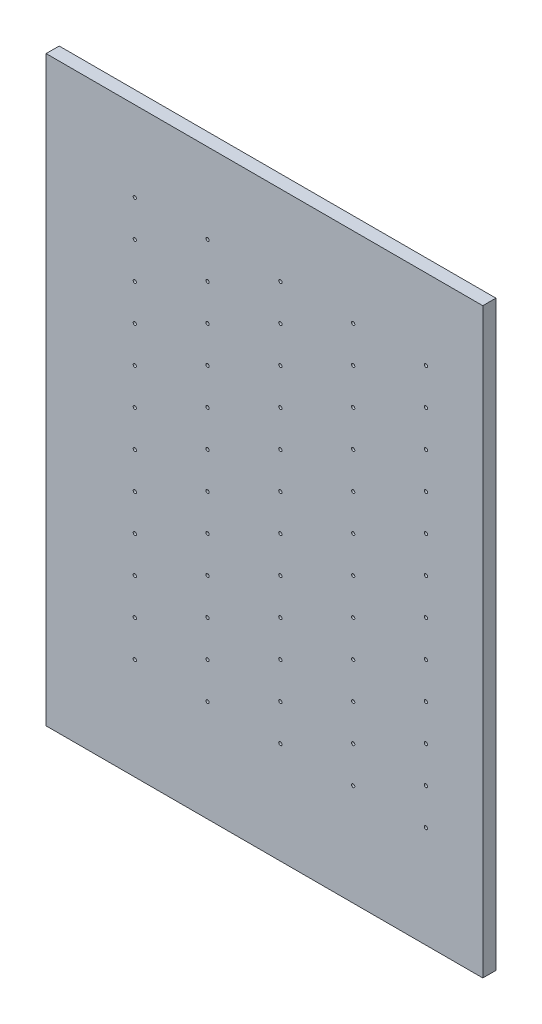
from build123d import *

# Parameters (mm, degrees)
SKETCH_1_W          = 600
SKETCH_1_H          = 800
EXTRUDE_1_DEPTH     = 18
SKETCH_2_R          = 2.25
CUT_EXTRUDE_1_DEPTH = 9


with BuildPart() as part:
    # Эскиз1 → Бобышка-Вытянуть1 (new body)
    with BuildSketch(Plane.XY):
        with Locations((300, 400)):
            Rectangle(SKETCH_1_W, SKETCH_1_H)
    extrude(amount=EXTRUDE_1_DEPTH)

    # Эскиз2 → Вырез-Вытянуть1 (cut)
    with BuildSketch(Plane.XY.offset(18)):
        with Locations((521.874452748, 139.781472365)):
            Circle(SKETCH_2_R)
        with Locations((421.874452748, 139.781472365)):
            Circle(SKETCH_2_R)
        with Locations((321.874452748, 139.781472365)):
            Circle(SKETCH_2_R)
        with Locations((221.874452748, 139.781472365)):
            Circle(SKETCH_2_R)
        with Locations((121.874452748, 139.781472365)):
            Circle(SKETCH_2_R)
        with Locations((421.874452748, 189.781472365)):
            Circle(SKETCH_2_R)
        with Locations((321.874452748, 189.781472365)):
            Circle(SKETCH_2_R)
        with Locations((221.874452748, 189.781472365)):
            Circle(SKETCH_2_R)
        with Locations((121.874452748, 189.781472365)):
            Circle(SKETCH_2_R)
        with Locations((421.874452748, 239.781472365)):
            Circle(SKETCH_2_R)
        with Locations((321.874452748, 239.781472365)):
            Circle(SKETCH_2_R)
        with Locations((221.874452748, 239.781472365)):
            Circle(SKETCH_2_R)
        with Locations((121.874452748, 239.781472365)):
            Circle(SKETCH_2_R)
        with Locations((421.874452748, 289.781472365)):
            Circle(SKETCH_2_R)
        with Locations((321.874452748, 289.781472365)):
            Circle(SKETCH_2_R)
        with Locations((221.874452748, 289.781472365)):
            Circle(SKETCH_2_R)
        with Locations((121.874452748, 289.781472365)):
            Circle(SKETCH_2_R)
        with Locations((421.874452748, 339.781472365)):
            Circle(SKETCH_2_R)
        with Locations((321.874452748, 339.781472365)):
            Circle(SKETCH_2_R)
        with Locations((221.874452748, 339.781472365)):
            Circle(SKETCH_2_R)
        with Locations((121.874452748, 339.781472365)):
            Circle(SKETCH_2_R)
        with Locations((421.874452748, 389.781472365)):
            Circle(SKETCH_2_R)
        with Locations((321.874452748, 389.781472365)):
            Circle(SKETCH_2_R)
        with Locations((221.874452748, 389.781472365)):
            Circle(SKETCH_2_R)
        with Locations((121.874452748, 389.781472365)):
            Circle(SKETCH_2_R)
        with Locations((421.874452748, 439.781472365)):
            Circle(SKETCH_2_R)
        with Locations((321.874452748, 439.781472365)):
            Circle(SKETCH_2_R)
        with Locations((221.874452748, 439.781472365)):
            Circle(SKETCH_2_R)
        with Locations((121.874452748, 439.781472365)):
            Circle(SKETCH_2_R)
        with Locations((421.874452748, 489.781472365)):
            Circle(SKETCH_2_R)
        with Locations((321.874452748, 489.781472365)):
            Circle(SKETCH_2_R)
        with Locations((221.874452748, 489.781472365)):
            Circle(SKETCH_2_R)
        with Locations((121.874452748, 489.781472365)):
            Circle(SKETCH_2_R)
        with Locations((421.874452748, 539.781472365)):
            Circle(SKETCH_2_R)
        with Locations((321.874452748, 539.781472365)):
            Circle(SKETCH_2_R)
        with Locations((221.874452748, 539.781472365)):
            Circle(SKETCH_2_R)
        with Locations((121.874452748, 539.781472365)):
            Circle(SKETCH_2_R)
        with Locations((421.874452748, 589.781472365)):
            Circle(SKETCH_2_R)
        with Locations((321.874452748, 589.781472365)):
            Circle(SKETCH_2_R)
        with Locations((221.874452748, 589.781472365)):
            Circle(SKETCH_2_R)
        with Locations((121.874452748, 589.781472365)):
            Circle(SKETCH_2_R)
        with Locations((421.874452748, 639.781472365)):
            Circle(SKETCH_2_R)
        with Locations((321.874452748, 639.781472365)):
            Circle(SKETCH_2_R)
        with Locations((221.874452748, 639.781472365)):
            Circle(SKETCH_2_R)
        with Locations((121.874452748, 639.781472365)):
            Circle(SKETCH_2_R)
        with Locations((421.874452748, 689.781472365)):
            Circle(SKETCH_2_R)
        with Locations((321.874452748, 689.781472365)):
            Circle(SKETCH_2_R)
        with Locations((221.874452748, 689.781472365)):
            Circle(SKETCH_2_R)
        with Locations((121.874452748, 689.781472365)):
            Circle(SKETCH_2_R)
        with Locations((521.874452748, 189.781472365)):
            Circle(SKETCH_2_R)
        with Locations((521.874452748, 239.781472365)):
            Circle(SKETCH_2_R)
        with Locations((521.874452748, 289.781472365)):
            Circle(SKETCH_2_R)
        with Locations((521.874452748, 339.781472365)):
            Circle(SKETCH_2_R)
        with Locations((521.874452748, 389.781472365)):
            Circle(SKETCH_2_R)
        with Locations((521.874452748, 439.781472365)):
            Circle(SKETCH_2_R)
        with Locations((521.874452748, 489.781472365)):
            Circle(SKETCH_2_R)
        with Locations((521.874452748, 539.781472365)):
            Circle(SKETCH_2_R)
        with Locations((521.874452748, 589.781472365)):
            Circle(SKETCH_2_R)
        with Locations((521.874452748, 639.781472365)):
            Circle(SKETCH_2_R)
        with Locations((521.874452748, 689.781472365)):
            Circle(SKETCH_2_R)
    extrude(amount=-CUT_EXTRUDE_1_DEPTH, mode=Mode.SUBTRACT)


solid = part.part
